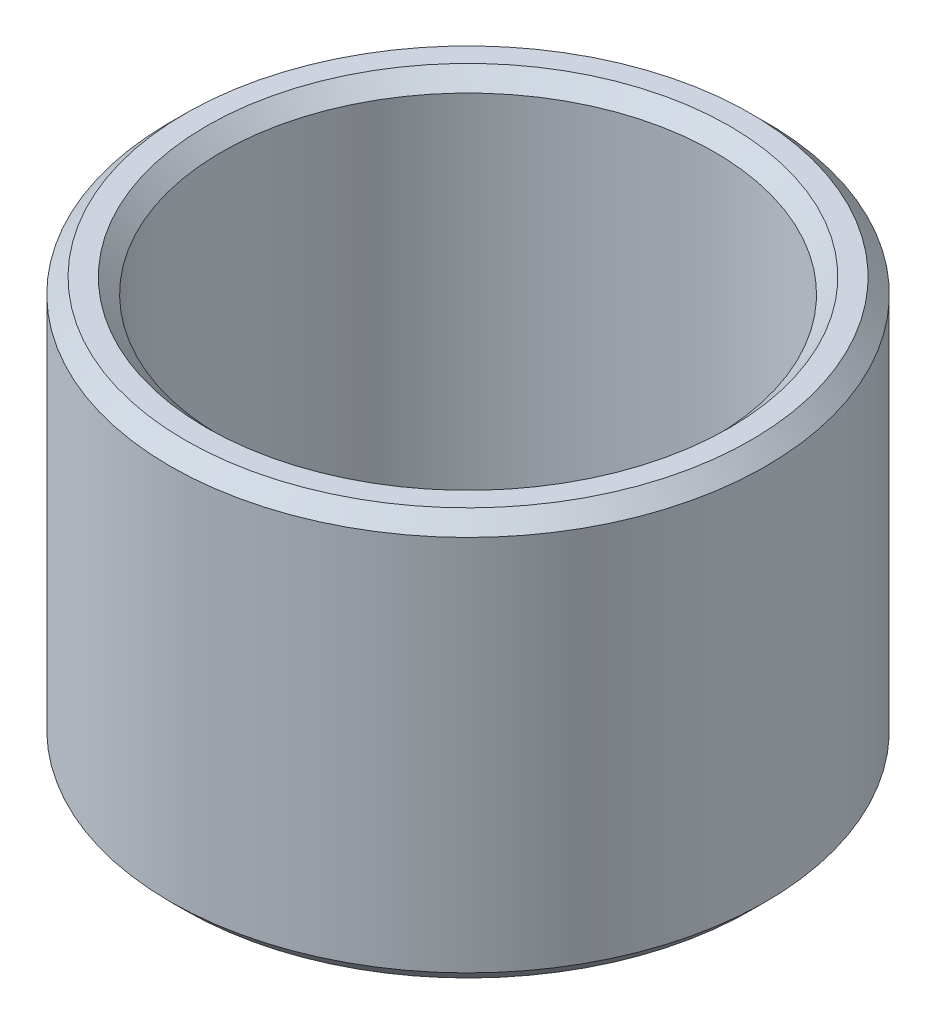
from build123d import *

# Parameters (mm, degrees)
SKETCH1_R           = 40
BOSS_EXTRUDE1_DEPTH = 54.670801696
SKETCH2_R           = 33.088368087
CUT_EXTRUDE1_DEPTH  = 79.669540218
CHAMFER1_SIZE       = 2.017874857


with BuildPart() as part:
    # Sketch1 → Boss-Extrude1 (new body)
    with BuildSketch(Plane(origin=(0, 0, 0), x_dir=(1, 0, 0), z_dir=(0, 1, 0))):
        Circle(SKETCH1_R)
    extrude(amount=BOSS_EXTRUDE1_DEPTH)

    # Sketch2 → Cut-Extrude1 (cut, through all)
    with BuildSketch(Plane(origin=(0, 0, 0), x_dir=(1, 0, 0), z_dir=(0, 1, 0))):
        Circle(SKETCH2_R)
    extrude(amount=CUT_EXTRUDE1_DEPTH, mode=Mode.SUBTRACT)

    # Chamfer1
    chamfer1_edges = [part.edges().sort_by_distance(p)[0] for p in [
        (-33.088368087, 54.670801696, 0),
        (-33.088368087, 0, 0),
        (-40, 0, 0),
        (-40, 54.670801696, 0),
    ]]
    chamfer(chamfer1_edges, length=CHAMFER1_SIZE)


solid = part.part
